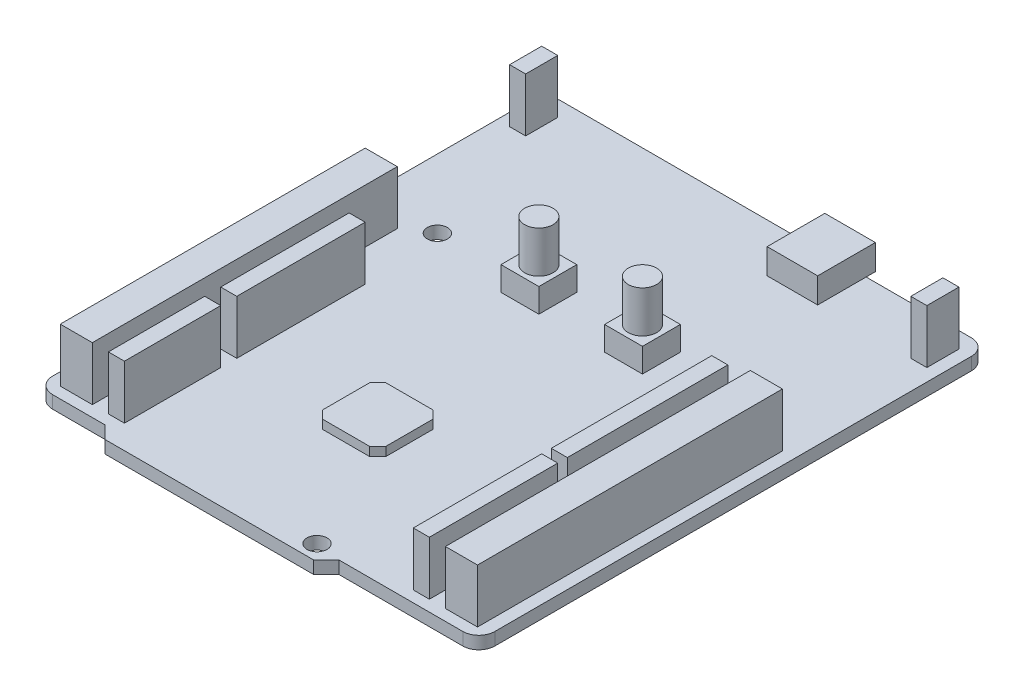
from build123d import *

# Parameters (mm, degrees)
SKETCH1_W           = 70
SKETCH1_H           = 82.5
BOSS_EXTRUDE1_DEPTH = 2
SKETCH2_R           = 1.5875
CUT_EXTRUDE1_DEPTH  = 55.134670037
FILLET1_R           = 2.54
SKETCH2_3_W         = 5.08
SKETCH2_3_H         = 48.26
SKETCH2_3_W_2       = 2.54
SKETCH2_3_H_2       = 25.4
SKETCH2_3_H_3       = 20.32
SKETCH2_3_H_4       = 15.24
SKETCH2_3_H_5       = 5.08
BOSS_EXTRUDE2_DEPTH = 8.5
SKETCH4_W           = 8
SKETCH4_H           = 9.13
BOSS_EXTRUDE3_DEPTH = 4
SKETCH4_3_W         = 6
SKETCH4_3_H         = 6
BOSS_EXTRUDE4_DEPTH = 3.8
SKETCH5_R           = 2.25
BOSS_EXTRUDE5_DEPTH = 6.6
SKETCH6_W           = 10
SKETCH6_H           = 10
BOSS_EXTRUDE6_DEPTH = 1.4
CHAMFER1_SIZE       = 1.27


with BuildPart() as part:
    # Sketch1 → Boss-Extrude1 (new body)
    with BuildSketch(Plane(origin=(0, 0, 0), x_dir=(1, 0, 0), z_dir=(0, 1, 0))):
        Rectangle(SKETCH1_W, SKETCH1_H)
    extrude(amount=BOSS_EXTRUDE1_DEPTH)

    # Sketch2 → Cut-Extrude1 (cut, through all)
    with BuildSketch(Plane(origin=(0, 2, 0), x_dir=(1, 0, 0), z_dir=(0, 1, 0))):
        with Locations((8.89, -38.75)):
            Circle(SKETCH2_R)
        with Locations((24.13, 12.05)):
            Circle(SKETCH2_R)
        with Locations((-24.13, 13.32)):
            Circle(SKETCH2_R)
        Polygon((-35, -41.25), (-35, -39.25), (-24.13, -39.25), (-22.13, -41.25), align=None)
        Polygon((35, -39.25), (12.87, -39.25), (10.87, -41.25), (35, -41.25), align=None)
    extrude(amount=-CUT_EXTRUDE1_DEPTH, mode=Mode.SUBTRACT)

    # Fillet1
    fillet1_edges = [part.edges().sort_by_distance(p)[0] for p in [
        (-35, 1, -41.25),
        (35, 1, -41.25),
        (35, 1, 39.25),
        (-35, 1, 39.25),
    ]]
    fillet(fillet1_edges, radius=FILLET1_R)

    # Sketch2<3> → Boss-Extrude2 (add)
    with BuildSketch(Plane(origin=(0, 2, 0), x_dir=(1, 0, 0), z_dir=(0, 1, 0))):
        with Locations((30.48, -13.35)):
            Rectangle(SKETCH2_3_W, SKETCH2_3_H)
        with Locations((-30.48, -13.35)):
            Rectangle(SKETCH2_3_W, SKETCH2_3_H)
        with Locations((24.13, -2.94)):
            Rectangle(SKETCH2_3_W_2, SKETCH2_3_H_2)
        with Locations((24.13, -27.32)):
            Rectangle(SKETCH2_3_W_2, SKETCH2_3_H_3)
        with Locations((-24.13, -9.54)):
            Rectangle(SKETCH2_3_W_2, SKETCH2_3_H_3)
        with Locations((-24.13, -29.86)):
            Rectangle(SKETCH2_3_W_2, SKETCH2_3_H_4)
        with Locations((-31.75, 36.18)):
            Rectangle(SKETCH2_3_W_2, SKETCH2_3_H_5)
        with Locations((31.75, 36.18)):
            Rectangle(SKETCH2_3_W_2, SKETCH2_3_H_5)
    extrude(amount=BOSS_EXTRUDE2_DEPTH)

    # Sketch4 → Boss-Extrude3 (add)
    with BuildSketch(Plane(origin=(0, 2, 0), x_dir=(1, 0, 0), z_dir=(0, 1, 0))):
        with Locations((11.8, 38.145)):
            Rectangle(SKETCH4_W, SKETCH4_H)
    extrude(amount=BOSS_EXTRUDE3_DEPTH)

    # Sketch4<3> → Boss-Extrude4 (add)
    with BuildSketch(Plane(origin=(0, 2, 0), x_dir=(1, 0, 0), z_dir=(0, 1, 0))):
        with Locations((-8, 13.25)):
            Rectangle(SKETCH4_3_W, SKETCH4_3_H)
        with Locations((8.4, 13.25)):
            Rectangle(SKETCH4_3_W, SKETCH4_3_H)
    extrude(amount=BOSS_EXTRUDE4_DEPTH)

    # Sketch5 → Boss-Extrude5 (add)
    with BuildSketch(Plane(origin=(0, 5.8, 0), x_dir=(1, 0, 0), z_dir=(0, 1, 0))):
        with Locations((-8, 13.25)):
            Circle(SKETCH5_R)
        with Locations((8.4, 13.25)):
            Circle(SKETCH5_R)
    extrude(amount=BOSS_EXTRUDE5_DEPTH)

    # Sketch6 → Boss-Extrude6 (add)
    with BuildSketch(Plane(origin=(0, 2, 0), x_dir=(1, 0, 0), z_dir=(0, 1, 0))):
        with Locations((-2.6, -17.65)):
            Rectangle(SKETCH6_W, SKETCH6_H)
    extrude(amount=BOSS_EXTRUDE6_DEPTH)

    # Chamfer1
    chamfer1_edges = [part.edges().sort_by_distance(p)[0] for p in [
        (2.4, 2.7, 22.65),
        (2.4, 2.7, 12.65),
        (-7.6, 2.7, 12.65),
        (-7.6, 2.7, 22.65),
    ]]
    chamfer(chamfer1_edges, length=CHAMFER1_SIZE)


solid = part.part
